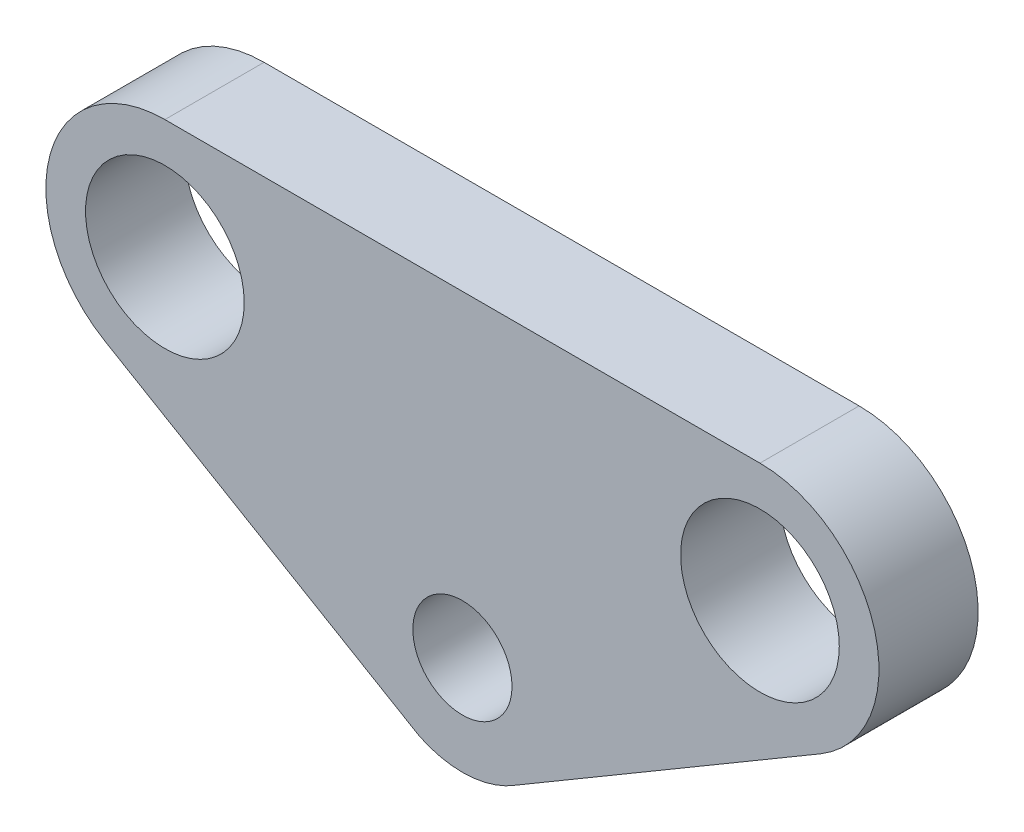
from build123d import *

# Parameters (mm, degrees)
SKETCH1_R           = 2.5
SKETCH1_R_2         = 4
BOSS_EXTRUDE1_DEPTH = 5


with BuildPart() as part:
    # Sketch1 → Boss-Extrude1 (new body)
    with BuildSketch(Plane.XY):
        with BuildLine():
            Line((15, 16), (-15, 16))
            ThreePointArc((-15, 16), (-20.78870249, 11.578265975), (-18.045370726, 4.830307829))
            Line((-18.045370726, 4.830307829), (-2.161999917, -4.508409515))
            ThreePointArc((-2.161999917, -4.508409515), (0.295396428, -4.991266468), (2.678684336, -4.221924943))
            Line((2.678684336, -4.221924943), (18.045370726, 4.830307829))
            ThreePointArc((18.045370726, 4.830307829), (20.78870249, 11.578265975), (15, 16))
        make_face()
        Circle(SKETCH1_R, mode=Mode.SUBTRACT)
        with Locations((-15, 10)):
            Circle(SKETCH1_R_2, mode=Mode.SUBTRACT)
        with Locations((15, 10)):
            Circle(SKETCH1_R_2, mode=Mode.SUBTRACT)
    extrude(amount=BOSS_EXTRUDE1_DEPTH)


solid = part.part
